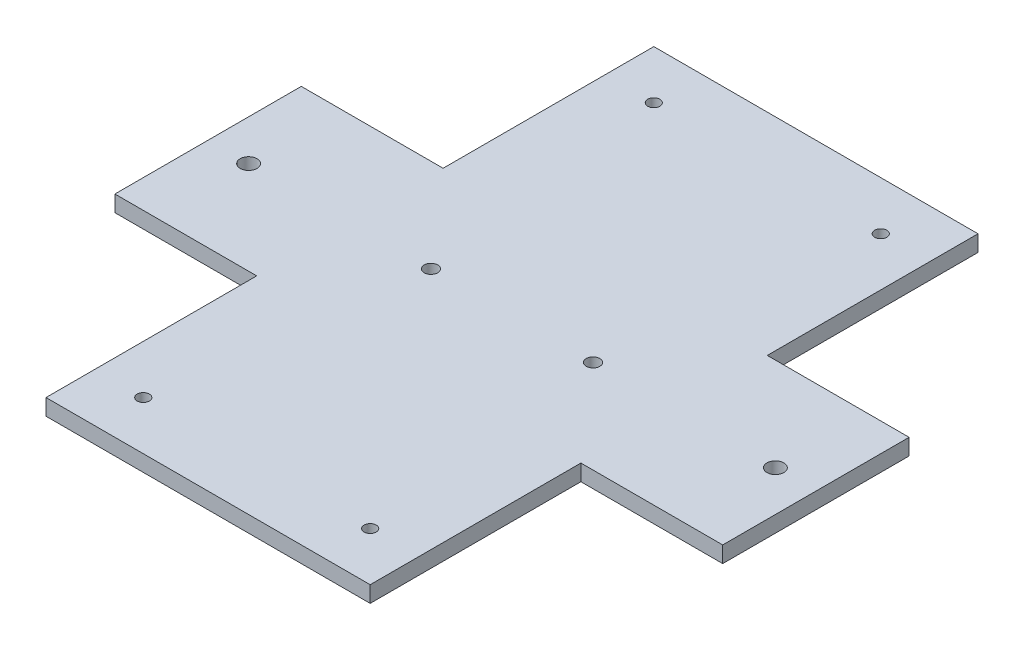
from build123d import *

# Parameters (mm, degrees)
SKETCH1_R           = 1.678248691
SKETCH1_R_2         = 2.082777924
SKETCH1_R_3         = 1.5
BOSS_EXTRUDE1_DEPTH = 4


with BuildPart() as part:
    # Sketch1 → Boss-Extrude1 (new body)
    with BuildSketch(Plane(origin=(0, 0, 0), x_dir=(1, 0, 0), z_dir=(0, 1, 0))):
        Polygon((-75, -23), (-40, -23), (-40, -75), (40, -75), (40, -23), (75, -23), (75, 23), (40, 23), (40, 75), (-40, 75), (-40, 23), (-75, 23), align=None)
        with Locations((20, 0)):
            Circle(SKETCH1_R, mode=Mode.SUBTRACT)
        with Locations((65, 0)):
            Circle(SKETCH1_R_2, mode=Mode.SUBTRACT)
        with Locations((-65, 0)):
            Circle(SKETCH1_R_2, mode=Mode.SUBTRACT)
        with Locations((-20, 0)):
            Circle(SKETCH1_R, mode=Mode.SUBTRACT)
        with Locations((-28, 63)):
            Circle(SKETCH1_R_3, mode=Mode.SUBTRACT)
        with Locations((28, 63)):
            Circle(SKETCH1_R_3, mode=Mode.SUBTRACT)
        with Locations((28, -63)):
            Circle(SKETCH1_R_3, mode=Mode.SUBTRACT)
        with Locations((-28, -63)):
            Circle(SKETCH1_R_3, mode=Mode.SUBTRACT)
    extrude(amount=BOSS_EXTRUDE1_DEPTH)


solid = part.part
